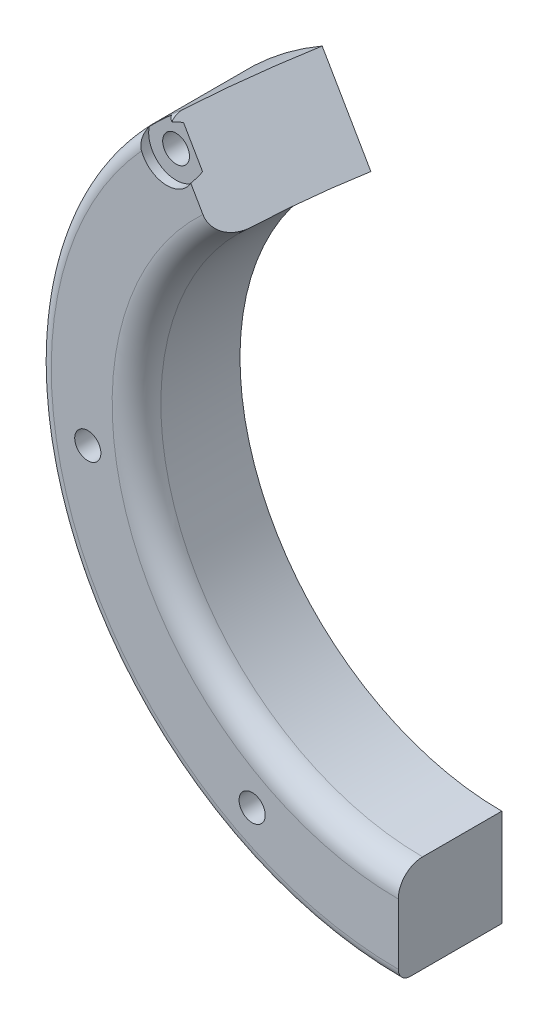
from build123d import *

# Parameters (mm, degrees)
BOSS_EXTRUDE1_DEPTH = 17
SKETCH2_R           = 2.2
CUT_EXTRUDE1_DEPTH  = 86.152803829
CUT_EXTRUDE2_DEPTH  = 86.152803829
DRAFT1_ANGLE        = -32
SKETCH4_R           = 4.5
CUT_EXTRUDE3_DEPTH  = 1.5
FILLET1_R           = 4
CUT_EXTRUDE4_START  = -2
CUT_EXTRUDE4_DEPTH  = 4
SKETCH10_R          = 1.25
CUT_EXTRUDE5_DEPTH  = 86.152803849
SKETCH11_R          = 2.15
CUT_EXTRUDE6_DEPTH  = 14
FILLET2_R           = 2


with BuildPart() as part:
    # Sketch1 → Boss-Extrude1 (new body)
    with BuildSketch(Plane.XY):
        with BuildLine():
            Line((0, 59), (0, 43))
            ThreePointArc((0, 43), (-43, 0), (0, -43))
            Line((0, -43), (0, -59))
            ThreePointArc((0, -59), (-59, 0), (0, 59))
        make_face()
    extrude(amount=BOSS_EXTRUDE1_DEPTH)

    # Sketch2 → Cut-Extrude1 (cut, through all)
    with BuildSketch(Plane.XY.offset(17)):
        with Locations((-38, 40)):
            Circle(SKETCH2_R)
    extrude(amount=-CUT_EXTRUDE1_DEPTH, mode=Mode.SUBTRACT)

    # Sketch3 → Cut-Extrude2 (cut, through all)
    with BuildSketch(Plane.XY.offset(17)):
        Polygon((0, 0), (-48.717134113, 84.380551482), (0, 84.380551482), align=None)
    extrude(amount=-CUT_EXTRUDE2_DEPTH, mode=Mode.SUBTRACT)

    # Draft1
    draft1_faces = [part.faces().sort_by_distance(p)[0] for p in [
        (-25.5, 44.167295593, 8.5),
    ]]
    draft(draft1_faces, Plane(origin=(0, 0, 0), x_dir=(-1, 0, 0), z_dir=(0, 0, -1)), DRAFT1_ANGLE)

    # Sketch4 → Cut-Extrude3 (cut)
    with BuildSketch(Plane.XY.offset(17)):
        with Locations((-38, 40)):
            Circle(SKETCH4_R)
    extrude(amount=-CUT_EXTRUDE3_DEPTH, mode=Mode.SUBTRACT)

    # Fillet1
    fillet1_edges = [part.edges().sort_by_distance(p)[0] for p in [
        (-39.826243941, -16.213275226, 17),
    ]]
    fillet(fillet1_edges, radius=FILLET1_R)

    # Sketch9 → Cut-Extrude4 (cut)
    with BuildSketch(Plane(origin=(0, 0, 0), x_dir=(-1, 0, 0), z_dir=(0, 0, -1)).offset(CUT_EXTRUDE4_START)):
        Polygon((40.91436799, 37.11732892), (41.953650381, 41.082581175), (39.039282391, 43.965252255), (35.08563201, 42.88267108), (21.021032653, 28.663421982), (28.6051551, 21.353976547), align=None)
    extrude(amount=-CUT_EXTRUDE4_DEPTH, mode=Mode.SUBTRACT)

    # Sketch10 → Cut-Extrude5 (cut, through all)
    with BuildSketch(Plane(origin=(0, 0, 0), x_dir=(-1, 0, 0), z_dir=(0, 0, -1))):
        with Locations((24, -46)):
            Circle(SKETCH10_R)
        with Locations((51, -8)):
            Circle(SKETCH10_R)
    extrude(amount=-CUT_EXTRUDE5_DEPTH, mode=Mode.SUBTRACT)

    # Sketch11 → Cut-Extrude6 (cut)
    with BuildSketch(Plane.XY.offset(17)):
        with Locations((-51, -8)):
            Circle(SKETCH11_R)
        with Locations((-24, -46)):
            Circle(SKETCH11_R)
    extrude(amount=-CUT_EXTRUDE6_DEPTH, mode=Mode.SUBTRACT)

    # Fillet2
    # the kernel refuses this fillet: 2 mm, written as the material it takes off along each edge
    with BuildSketch(Plane(origin=(0, 0, 17), x_dir=(-0.7194630608537799, 0.6945307077926146, 0), z_dir=(-0.6945307077926146, -0.7194630608537799, 0))) as fillet2_piece_1:
        with BuildLine():
            CenterArc((59 - FILLET2_R, FILLET2_R), FILLET2_R, 270, 90)
            Line((59 - FILLET2_R, 0), (59, 0))
            Line((59, 0), (59, FILLET2_R))
        make_face()
    revolve(axis=Axis((0, 0, 17), (0, 0, -1)), revolution_arc=10.493238867, mode=Mode.SUBTRACT)
    with BuildSketch(Plane(origin=(0, 0, 17), x_dir=(0.08471968524952049, -0.9964048248233356, 0), z_dir=(0.9964048248233356, 0.08471968524952049, 0))) as fillet2_piece_2:
        with BuildLine():
            CenterArc((59 - FILLET2_R, FILLET2_R), FILLET2_R, 270, 90)
            Line((59, FILLET2_R), (59, 0))
            Line((59, 0), (59 - FILLET2_R, 0))
        make_face()
    revolve(axis=Axis((0, 0, 17), (0, 0, -1)), revolution_arc=143.812006021, mode=Mode.SUBTRACT)


solid = part.part
